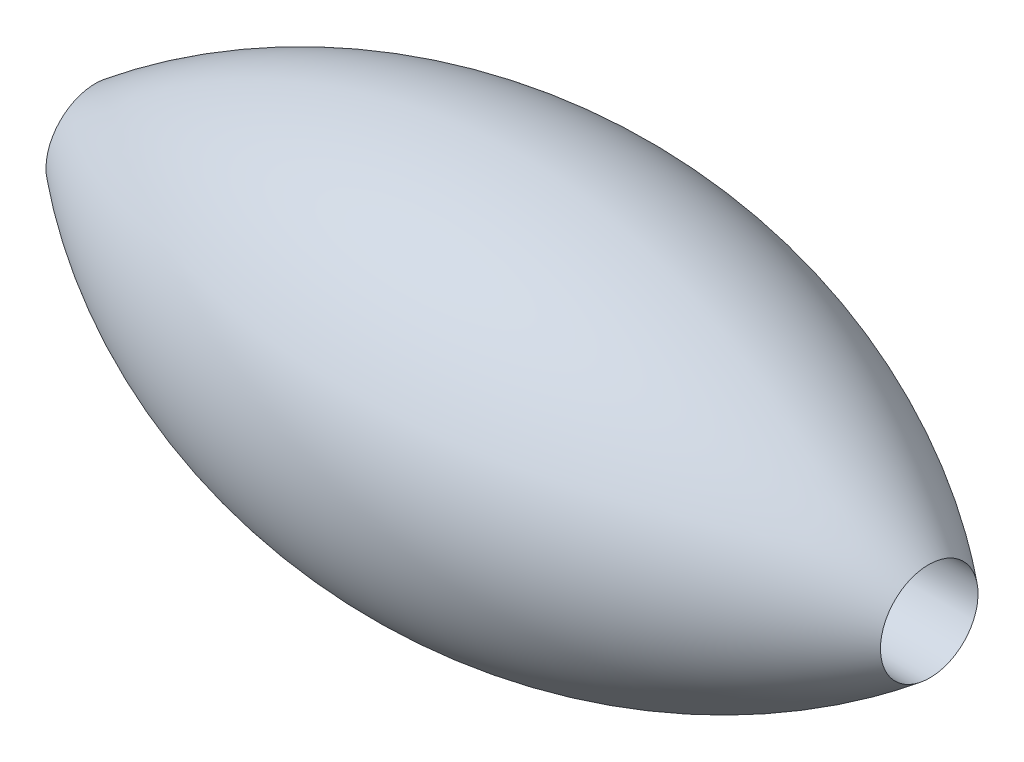
from build123d import *

# Parameters (mm, degrees)
CUT_EXTRUDE1_DEPTH      = 9.630623569
CUT_EXTRUDE1_DEPTH_BACK = 9.630623569
SKETCH2_R               = 0.75


with BuildPart() as part:
    # Sketch1 → Revolve1 (revolve)
    with BuildSketch(Plane.XY):
        with BuildLine():
            Line((-7.512965189, -0.007160548), (6.992555135, -0.007160548))
            ThreePointArc((6.992555135, -0.007160548), (-0.260205027, -3.007160548), (-7.512965189, -0.007160548))
        make_face()
    revolve(axis=Axis((-7.512965189, -0.007160548, 0), (1, 0, 0)))

    # Sketch2 → Cut-Extrude1 (cut, two sides: drawn at the far end of the back side and taken through both)
    with BuildSketch(Plane(origin=(0, 0, 0), x_dir=(0, 0, -1), z_dir=(1, 0, 0)).offset(-CUT_EXTRUDE1_DEPTH_BACK)):
        Circle(SKETCH2_R)
    extrude(amount=CUT_EXTRUDE1_DEPTH + CUT_EXTRUDE1_DEPTH_BACK, mode=Mode.SUBTRACT)


solid = part.part
